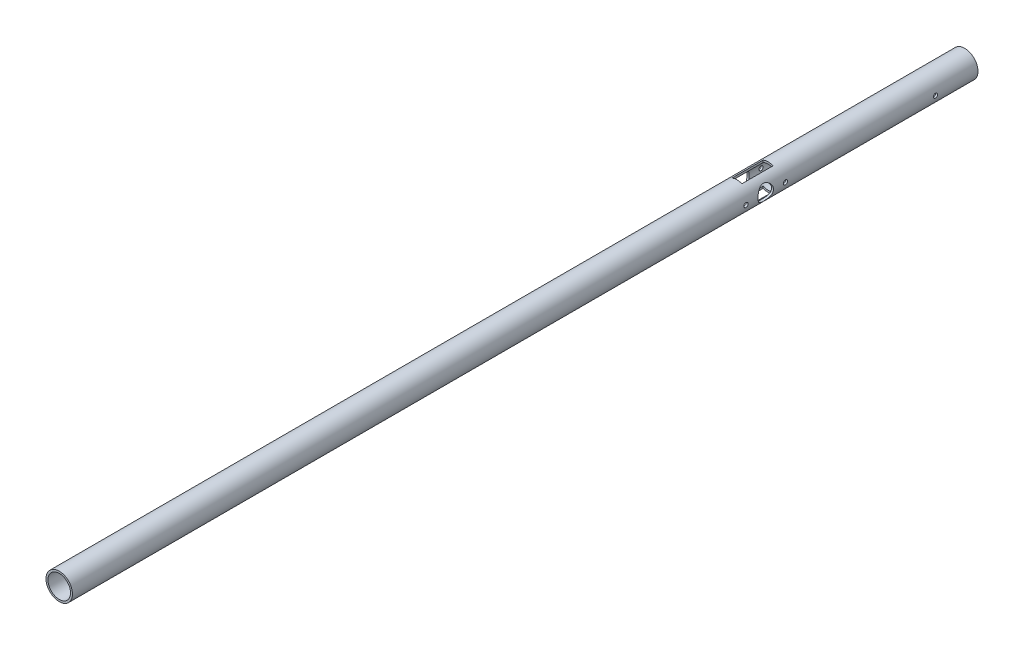
from build123d import *

# Parameters (mm, degrees)
SKETCH1_R           = 9.36
SKETCH1_R_2         = 7.99
EXTRUDE1_DEPTH      = 640
EXTRUDE2_DEPTH      = 641.136875363
EXTRUDE2_DEPTH_BACK = 641.136875363
SKETCH2_R           = 1.5
SKETCH2_R_2         = 5.5
EXTRUDE3_DEPTH      = 25
EXTRUDE3_DEPTH_BACK = 25
SKETCH3_W           = 7
SKETCH3_H           = 22


with BuildPart() as part:
    # Sketch1 → Extrude1 (new body)
    with BuildSketch(Plane.XY):
        Circle(SKETCH1_R)
        Circle(SKETCH1_R_2, mode=Mode.SUBTRACT)
    extrude(amount=EXTRUDE1_DEPTH)

    # Sketch2 → Extrude2 (cut, two sides: drawn at the far end of the back side and taken through both)
    with BuildSketch(Plane(origin=(0, 0, 0), x_dir=(0, 0, -1), z_dir=(1, 0, 0)).offset(-EXTRUDE2_DEPTH_BACK)):
        with Locations((-30, 0)):
            Circle(SKETCH2_R)
        with Locations((-150, 0)):
            Circle(SKETCH2_R_2)
        with Locations((-136.0625, 0)):
            Circle(SKETCH2_R)
        with Locations((-163.9375, 0)):
            Circle(SKETCH2_R)
    extrude(amount=EXTRUDE2_DEPTH + EXTRUDE2_DEPTH_BACK, mode=Mode.SUBTRACT)

    # Sketch3 → Extrude3 (cut, two sides: drawn at the far end of the back side and taken through both)
    with BuildSketch(Plane(origin=(0, 0, 0), x_dir=(1, 0, 0), z_dir=(0, 1, 0)).offset(-EXTRUDE3_DEPTH_BACK)):
        with Locations((0, -150)):
            Rectangle(SKETCH3_W, SKETCH3_H)
    extrude(amount=EXTRUDE3_DEPTH + EXTRUDE3_DEPTH_BACK, mode=Mode.SUBTRACT)


solid = part.part
